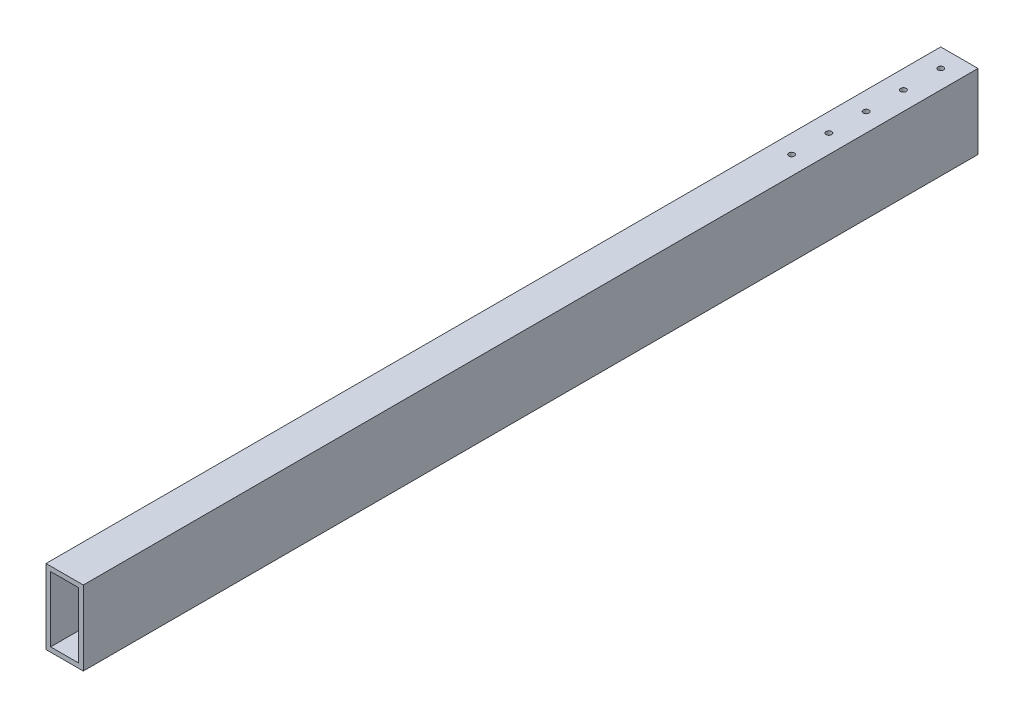
from build123d import *

# Parameters (mm, degrees)
SKETCH1_W           = 25.4
SKETCH1_H           = 50.8
SKETCH1_W_2         = 19.05
SKETCH1_H_2         = 44.45
BOSS_EXTRUDE1_DEPTH = 304.8
SKETCH7_R           = 1.905
CUT_EXTRUDE1_DEPTH  = 310.265209812


with BuildPart() as part:
    # Sketch1 → Boss-Extrude1 (new, symmetric)
    with BuildSketch(Plane.XY):
        Rectangle(SKETCH1_W, SKETCH1_H)
        Rectangle(SKETCH1_W_2, SKETCH1_H_2, mode=Mode.SUBTRACT)
    extrude(amount=BOSS_EXTRUDE1_DEPTH, both=True)

    # Sketch7 → Cut-Extrude1 (cut, through all)
    with BuildSketch(Plane(origin=(0, 25.4, 0), x_dir=(1, 0, 0), z_dir=(0, 1, 0))):
        with Locations((0, 292.1)):
            Circle(SKETCH7_R)
        with Locations((0, 266.7)):
            Circle(SKETCH7_R)
        with Locations((0, 241.3)):
            Circle(SKETCH7_R)
        with Locations((0, 215.9)):
            Circle(SKETCH7_R)
        with Locations((0, 190.5)):
            Circle(SKETCH7_R)
    extrude(amount=-CUT_EXTRUDE1_DEPTH, mode=Mode.SUBTRACT)


solid = part.part
